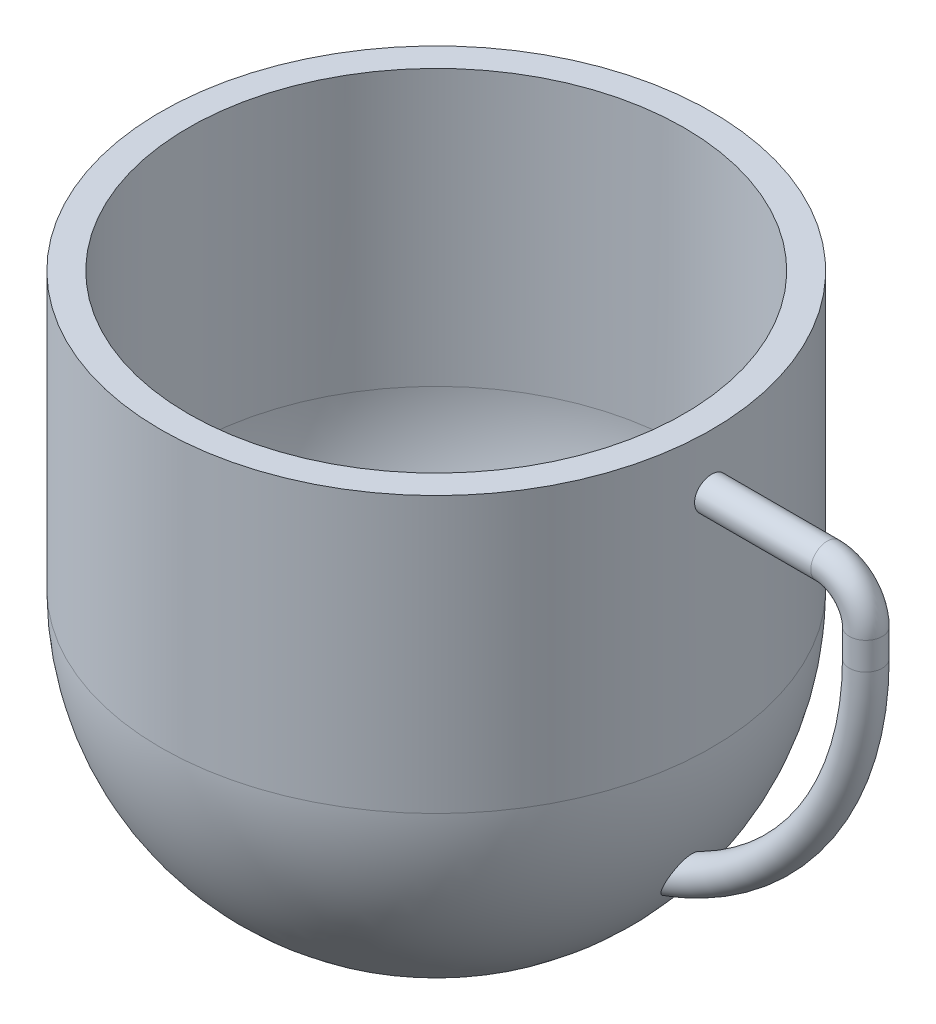
from build123d import *

# Parameters (mm, degrees)
SKETCH11_R         = 3
SKETCH14_R         = 28
CUT_EXTRUDE1_DEPTH = 2


# Read off the part's stored shape, not the designer's step: Shell4
with BuildPart() as part:
    # Sketch2 → Revolve1 (revolve)
    with BuildSketch(Plane.XY, mode=Mode.PRIVATE) as revolve1_sk:
        with BuildLine():
            Line((-40.101497772, 45), (-40.101497772, -45))
            Line((-40.101497772, -45), (-10.101497772, -45))
            ThreePointArc((-10.101497772, -45), (4.619861778, -27.360679775), (9.898502228, -5))
            Line((9.898502228, -5), (9.898502228, 45))
            Line((9.898502228, 45), (-40.101497772, 45))
        make_face()
    revolve(revolve1_sk.sketch.rotate(Axis((-40.101497772, 45, 0), (0, -1, 0)), 90), axis=Axis((-40.101497772, 45, 0), (0, -1, 0)))

    # Sweep16: sweep along a path in Sketch3
    with BuildLine(Plane.XY) as sweep16_path:
        Line((7.898502228, 35), (30.898502228, 35))
        ThreePointArc((30.898502228, 35), (35.848249696, 32.949747468), (37.898502228, 28))
        Line((37.898502228, 28), (37.898502228, 23))
        ThreePointArc((37.898502228, 23), (27.703635862, -8.898275815), (0.898502228, -28.971145841))
    # Sketch11 → Sweep16 (sweep)
    with BuildSketch(Plane(origin=(7.898502228, 0, 0), x_dir=(0, 0, -1), z_dir=(1, 0, 0))):
        with Locations((0, 35)):
            Circle(SKETCH11_R)
    sweep(path=sweep16_path.line)

    # Sketch14 → Cut-Extrude1 (cut)
    with BuildSketch(Plane.XZ.offset(45)):
        with Locations(Location((-40.101497772, 0, 0), (0, 0, 270))):
            Circle(SKETCH14_R)
    extrude(amount=-CUT_EXTRUDE1_DEPTH, mode=Mode.SUBTRACT)

    # Shell4 outline → Shell4 (revolve, cut)
    with BuildSketch(Plane(origin=(-40.101497772, 0, 0), x_dir=(1, 0, 0), z_dir=(0, 0, 1))):
        with BuildLine():
            ThreePointArc((32.999999984, -35.594117098), (41.89272013, -21.431676729), (45, -4.999999985))
            Line((45, -4.999999985), (45, 45))
            Line((45, 45), (0, 45))
            Line((0, 45), (0, -35))
            Line((0, -35), (33, -35))
            Line((33, -35), (32.999999984, -35.594117098))
        make_face()
    revolve(axis=Axis((-40.101497772, 0, 0), (0, 1, 0)), mode=Mode.SUBTRACT)


solid = part.part
